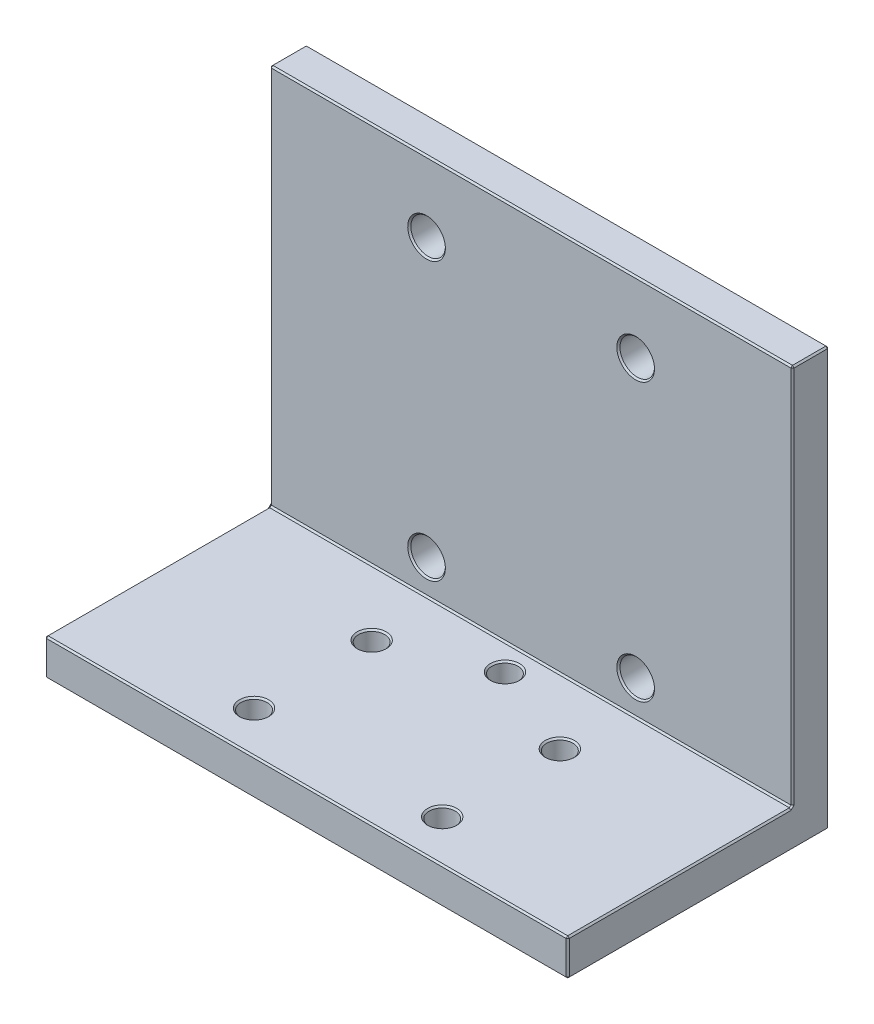
from build123d import *

# Parameters (mm, degrees)
BOSS_EXTRUDE1_DEPTH = 50
SKETCH2_R           = 3.3
CUT_EXTRUDE1_DEPTH  = 100
SKETCH3_R           = 2.5
CUT_EXTRUDE2_DEPTH  = 100
CHAMFER1_SIZE       = 0.3


with BuildPart() as part:
    # Sketch1 → Boss-Extrude1 (new, symmetric)
    with BuildSketch(Plane(origin=(0, 0, 0), x_dir=(0, 0, -1), z_dir=(1, 0, 0))):
        Polygon((0, 0), (0, 80), (-7, 80), (-7, 7), (-50, 7), (-50, 0), align=None)
    extrude(amount=BOSS_EXTRUDE1_DEPTH, both=True)

    # Sketch2 → Cut-Extrude1 (cut)
    with BuildSketch(Plane.XY.offset(7)):
        with Locations((-20, 66.5)):
            Circle(SKETCH2_R)
        with Locations((20, 66.5)):
            Circle(SKETCH2_R)
        with Locations((20, 13.5)):
            Circle(SKETCH2_R)
        with Locations((-20, 13.5)):
            Circle(SKETCH2_R)
    extrude(amount=-CUT_EXTRUDE1_DEPTH, mode=Mode.SUBTRACT)

    # Sketch3 → Cut-Extrude2 (cut)
    with BuildSketch(Plane(origin=(0, 7, 0), x_dir=(1, 0, 0), z_dir=(0, 1, 0))):
        with Locations((-18, -19.5)):
            Circle(SKETCH3_R)
        with Locations((-18, -42)):
            Circle(SKETCH3_R)
        with Locations((18, -42)):
            Circle(SKETCH3_R)
        with Locations((18, -19.5)):
            Circle(SKETCH3_R)
        with Locations((0, -12)):
            Circle(SKETCH3_R)
    extrude(amount=-CUT_EXTRUDE2_DEPTH, mode=Mode.SUBTRACT)

    # Chamfer1
    chamfer1_edges = [part.edges().sort_by_distance(p)[0] for p in [
        (-20.5, 7, 19.5),
        (-20.5, 7, 42),
        (15.5, 7, 42),
        (15.5, 7, 19.5),
        (-2.5, 7, 12),
        (-23.3, 66.5, 7),
        (16.7, 66.5, 7),
        (16.7, 13.5, 7),
        (-23.3, 13.5, 7),
        (50, 7, 28.5),
        (0, 7, 50),
        (-50, 7, 28.5),
        (0, 80, 7),
        (50, 43.5, 7),
        (0, 7, 7),
        (-50, 43.5, 7),
        (0, 0, 0),
        (0, 80, 0),
        (50, 3.5, 50),
        (50, 80, 3.5),
        (50, 40, 0),
        (50, 0, 25),
        (0, 0, 50),
        (-50, 3.5, 50),
        (-50, 80, 3.5),
        (-50, 40, 0),
        (-50, 0, 25),
        (-23.3, 66.5, 0),
        (16.7, 66.5, 0),
        (16.7, 13.5, 0),
        (-23.3, 13.5, 0),
        (-20.5, 0, 19.5),
        (-20.5, 0, 42),
        (15.5, 0, 42),
        (15.5, 0, 19.5),
        (-2.5, 0, 12),
    ]]
    chamfer(chamfer1_edges, length=CHAMFER1_SIZE)


solid = part.part
